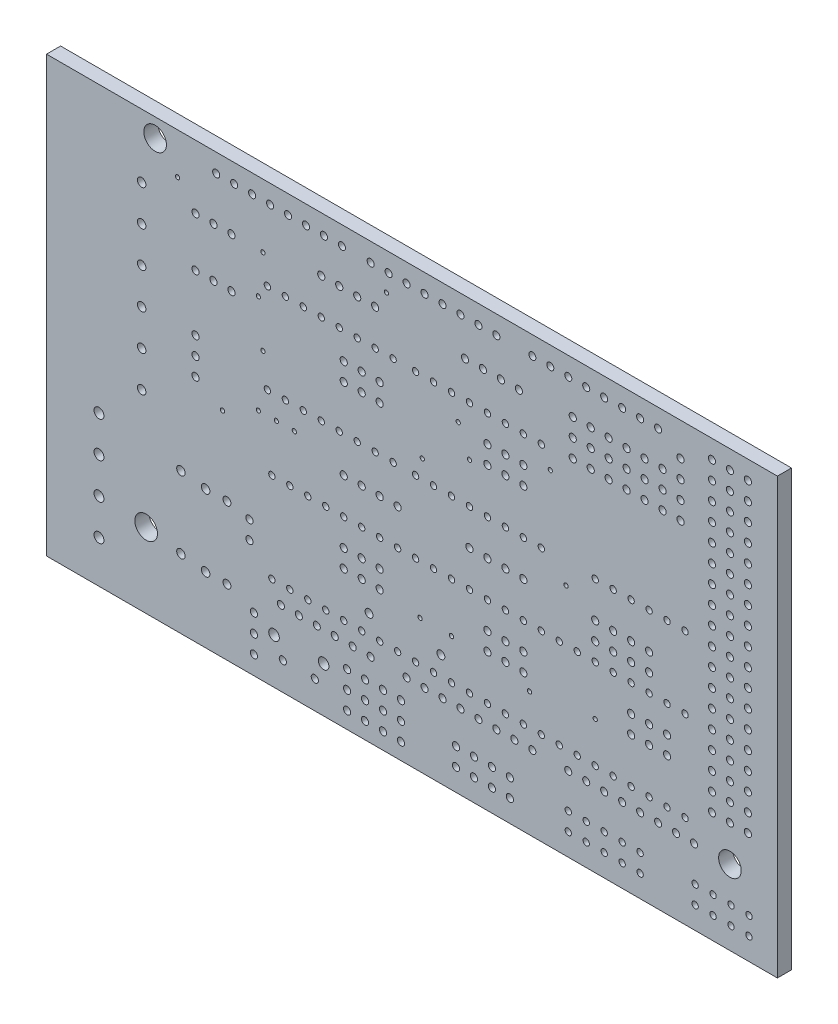
from build123d import *

# Parameters (mm, degrees)
SKETCH1_W           = 131.785247706
SKETCH1_H           = 94.524612159
SKETCH1_R           = 0.510484
SKETCH1_R_2         = 0.5615324
SKETCH1_R_3         = 0.602932652
SKETCH1_R_4         = 0.452212251
SKETCH1_R_5         = 0.7529639
SKETCH1_R_6         = 1.607820406
SKETCH1_R_7         = 0.502443877
SKETCH1_R_8         = 0.7019155
SKETCH1_R_9         = 0.301466326
BOSS_EXTRUDE1_DEPTH = 2
SKETCH4_W           = 136.062514885
SKETCH4_H           = 102.860022968
SKETCH4_W_2         = 103.854835648
SKETCH4_H_2         = 61.764941155
CUT_EXTRUDE1_DEPTH  = 10


with BuildPart() as part:
    # Sketch1 → Boss-Extrude1 (new body)
    with BuildSketch(Plane(origin=(-1.669568433, 0, 0), x_dir=(-1, 0, 0), z_dir=(0, 0, -1))):
        with Locations((-33.736575694, -25.94456792)):
            Rectangle(SKETCH1_W, SKETCH1_H)
        with Locations((-14.63831, -51.3453967)):
            Circle(SKETCH1_R, mode=Mode.SUBTRACT)
        with Locations((-14.000205, -37.600615)):
            Circle(SKETCH1_R, mode=Mode.SUBTRACT)
        with Locations((-14.000205, -40.153035)):
            Circle(SKETCH1_R, mode=Mode.SUBTRACT)
        with Locations((-43.353035, -50.841242702)):
            Circle(SKETCH1_R, mode=Mode.SUBTRACT)
        with Locations((-45.905455, -50.841242702)):
            Circle(SKETCH1_R, mode=Mode.SUBTRACT)
        with Locations((-48.457875, -50.841242702)):
            Circle(SKETCH1_R, mode=Mode.SUBTRACT)
        with Locations((-51.010295, -50.841242702)):
            Circle(SKETCH1_R, mode=Mode.SUBTRACT)
        with Locations((-41.208389619, -40.662217266)):
            Circle(SKETCH1_R_2, mode=Mode.SUBTRACT)
        with Locations((-30.998709619, -40.662217266)):
            Circle(SKETCH1_R_2, mode=Mode.SUBTRACT)
        with Locations((-10.80968, -47.17219)):
            Circle(SKETCH1_R_2, mode=Mode.SUBTRACT)
        with Locations((-10.80968, -36.96251)):
            Circle(SKETCH1_R_2, mode=Mode.SUBTRACT)
        with Locations((-24.209782903, -2.50484)):
            Circle(SKETCH1_R, mode=Mode.SUBTRACT)
        with Locations((-26.762202903, -2.50484)):
            Circle(SKETCH1_R, mode=Mode.SUBTRACT)
        with Locations((-29.314622903, -2.50484)):
            Circle(SKETCH1_R, mode=Mode.SUBTRACT)
        with Locations((-31.867042903, -2.50484)):
            Circle(SKETCH1_R, mode=Mode.SUBTRACT)
        with Locations((-44.629245, -2.50484)):
            Circle(SKETCH1_R, mode=Mode.SUBTRACT)
        with Locations((-47.181665, -2.50484)):
            Circle(SKETCH1_R, mode=Mode.SUBTRACT)
        with Locations((-49.734085, -2.50484)):
            Circle(SKETCH1_R, mode=Mode.SUBTRACT)
        with Locations((-52.286505, -2.50484)):
            Circle(SKETCH1_R, mode=Mode.SUBTRACT)
        with Locations((-7.778732298, -36.96251)):
            Circle(SKETCH1_R_3, mode=Mode.SUBTRACT)
        with Locations((-7.778732298, -47.17219)):
            Circle(SKETCH1_R_3, mode=Mode.SUBTRACT)
        with Locations((-4.269052702, -46.693662298)):
            Circle(SKETCH1_R_3, mode=Mode.SUBTRACT)
        with Locations((-4.269052702, -36.483982298)):
            Circle(SKETCH1_R_3, mode=Mode.SUBTRACT)
        with Locations((-75.258285, -7.131050202)):
            Circle(SKETCH1_R, mode=Mode.SUBTRACT)
        with Locations((-75.258285, -4.578630202)):
            Circle(SKETCH1_R, mode=Mode.SUBTRACT)
        with Locations((-75.258285, -2.026210202)):
            Circle(SKETCH1_R, mode=Mode.SUBTRACT)
        with Locations((-75.258285, 0.526209798)):
            Circle(SKETCH1_R, mode=Mode.SUBTRACT)
        with Locations((-27.40041, -13.99073)):
            Circle(SKETCH1_R, mode=Mode.SUBTRACT)
        with Locations((-27.40041, -11.43831)):
            Circle(SKETCH1_R, mode=Mode.SUBTRACT)
        with Locations((-29.95283, -13.99073)):
            Circle(SKETCH1_R, mode=Mode.SUBTRACT)
        with Locations((-29.95283, -11.43831)):
            Circle(SKETCH1_R, mode=Mode.SUBTRACT)
        with Locations((-32.50525, -13.99073)):
            Circle(SKETCH1_R, mode=Mode.SUBTRACT)
        with Locations((-32.50525, -11.43831)):
            Circle(SKETCH1_R, mode=Mode.SUBTRACT)
        with Locations((-47.81977, -13.99073)):
            Circle(SKETCH1_R, mode=Mode.SUBTRACT)
        with Locations((-47.81977, -11.43831)):
            Circle(SKETCH1_R, mode=Mode.SUBTRACT)
        with Locations((-50.37219, -13.99073)):
            Circle(SKETCH1_R, mode=Mode.SUBTRACT)
        with Locations((-50.37219, -11.43831)):
            Circle(SKETCH1_R, mode=Mode.SUBTRACT)
        with Locations((-52.92461, -13.99073)):
            Circle(SKETCH1_R, mode=Mode.SUBTRACT)
        with Locations((-52.92461, -11.43831)):
            Circle(SKETCH1_R, mode=Mode.SUBTRACT)
        with Locations((-27.40041, -36.96251)):
            Circle(SKETCH1_R, mode=Mode.SUBTRACT)
        with Locations((-27.40041, -34.41009)):
            Circle(SKETCH1_R, mode=Mode.SUBTRACT)
        with Locations((-29.95283, -36.96251)):
            Circle(SKETCH1_R, mode=Mode.SUBTRACT)
        with Locations((-29.95283, -34.41009)):
            Circle(SKETCH1_R, mode=Mode.SUBTRACT)
        with Locations((-32.50525, -36.96251)):
            Circle(SKETCH1_R, mode=Mode.SUBTRACT)
        with Locations((-32.50525, -34.41009)):
            Circle(SKETCH1_R, mode=Mode.SUBTRACT)
        with Locations((-47.81977, -36.96251)):
            Circle(SKETCH1_R, mode=Mode.SUBTRACT)
        with Locations((-47.81977, -34.41009)):
            Circle(SKETCH1_R, mode=Mode.SUBTRACT)
        with Locations((-50.37219, -36.96251)):
            Circle(SKETCH1_R, mode=Mode.SUBTRACT)
        with Locations((-50.37219, -34.41009)):
            Circle(SKETCH1_R, mode=Mode.SUBTRACT)
        with Locations((-52.92461, -36.96251)):
            Circle(SKETCH1_R, mode=Mode.SUBTRACT)
        with Locations((-52.92461, -34.41009)):
            Circle(SKETCH1_R, mode=Mode.SUBTRACT)
        with Locations((-68.23913, -36.96251)):
            Circle(SKETCH1_R, mode=Mode.SUBTRACT)
        with Locations((-68.23913, -34.41009)):
            Circle(SKETCH1_R, mode=Mode.SUBTRACT)
        with Locations((-70.79155, -36.96251)):
            Circle(SKETCH1_R, mode=Mode.SUBTRACT)
        with Locations((-70.79155, -34.41009)):
            Circle(SKETCH1_R, mode=Mode.SUBTRACT)
        with Locations((-73.34397, -36.96251)):
            Circle(SKETCH1_R, mode=Mode.SUBTRACT)
        with Locations((-73.34397, -34.41009)):
            Circle(SKETCH1_R, mode=Mode.SUBTRACT)
        with Locations((-63.13429, -20.37178)):
            Circle(SKETCH1_R_4, mode=Mode.SUBTRACT)
        with Locations((-65.68671, -20.37178)):
            Circle(SKETCH1_R_4, mode=Mode.SUBTRACT)
        with Locations((-68.23913, -20.37178)):
            Circle(SKETCH1_R_4, mode=Mode.SUBTRACT)
        with Locations((-70.79155, -20.37178)):
            Circle(SKETCH1_R_4, mode=Mode.SUBTRACT)
        with Locations((-73.34397, -20.37178)):
            Circle(SKETCH1_R_4, mode=Mode.SUBTRACT)
        with Locations((-75.89639, -20.37178)):
            Circle(SKETCH1_R_4, mode=Mode.SUBTRACT)
        with Locations((-14.63831, -53.8978167)):
            Circle(SKETCH1_R, mode=Mode.SUBTRACT)
        with Locations((-8.895262903, -3.78105)):
            Circle(SKETCH1_R, mode=Mode.SUBTRACT)
        with Locations((-11.447682903, -3.78105)):
            Circle(SKETCH1_R, mode=Mode.SUBTRACT)
        with Locations((-6.342842903, -3.78105)):
            Circle(SKETCH1_R, mode=Mode.SUBTRACT)
        with Locations((-8.895262903, -10.800307097)):
            Circle(SKETCH1_R, mode=Mode.SUBTRACT)
        with Locations((-11.447682903, -10.800307097)):
            Circle(SKETCH1_R, mode=Mode.SUBTRACT)
        with Locations((-6.342842903, -10.800307097)):
            Circle(SKETCH1_R, mode=Mode.SUBTRACT)
        with Locations((-6.343047097, -21.3289375)):
            Circle(SKETCH1_R, mode=Mode.SUBTRACT)
        with Locations((-6.343047097, -23.8813575)):
            Circle(SKETCH1_R, mode=Mode.SUBTRACT)
        with Locations((-6.343047097, -18.7765175)):
            Circle(SKETCH1_R, mode=Mode.SUBTRACT)
        with Locations((-18.7477062, -52.5705583)):
            Circle(SKETCH1_R, mode=Mode.SUBTRACT)
        with Locations((-23.2910138, -52.5705583)):
            Circle(SKETCH1_R, mode=Mode.SUBTRACT)
        with Locations((-17.4970204, -50.0691867)):
            Circle(SKETCH1_R_5, mode=Mode.SUBTRACT)
        with Locations((-24.5416996, -50.0691867)):
            Circle(SKETCH1_R_5, mode=Mode.SUBTRACT)
        with Locations((-27.878937702, -54.191447097)):
            Circle(SKETCH1_R, mode=Mode.SUBTRACT)
        with Locations((-27.878937702, -51.639027097)):
            Circle(SKETCH1_R, mode=Mode.SUBTRACT)
        with Locations((-27.878937702, -49.086607097)):
            Circle(SKETCH1_R, mode=Mode.SUBTRACT)
        with Locations((-30.431459798, -54.191345)):
            Circle(SKETCH1_R, mode=Mode.SUBTRACT)
        with Locations((-30.431459798, -51.638925)):
            Circle(SKETCH1_R, mode=Mode.SUBTRACT)
        with Locations((-30.431459798, -49.086505)):
            Circle(SKETCH1_R, mode=Mode.SUBTRACT)
        with Locations((-32.983777702, -54.191345)):
            Circle(SKETCH1_R, mode=Mode.SUBTRACT)
        with Locations((-32.983777702, -51.638925)):
            Circle(SKETCH1_R, mode=Mode.SUBTRACT)
        with Locations((-32.983777702, -49.086505)):
            Circle(SKETCH1_R, mode=Mode.SUBTRACT)
        with Locations((-35.536299798, -54.191345)):
            Circle(SKETCH1_R, mode=Mode.SUBTRACT)
        with Locations((-35.536299798, -51.638925)):
            Circle(SKETCH1_R, mode=Mode.SUBTRACT)
        with Locations((-35.536299798, -49.086505)):
            Circle(SKETCH1_R, mode=Mode.SUBTRACT)
        with Locations((-43.353035, -53.393764798)):
            Circle(SKETCH1_R, mode=Mode.SUBTRACT)
        with Locations((-45.905455, -53.393764798)):
            Circle(SKETCH1_R, mode=Mode.SUBTRACT)
        with Locations((-48.457875, -53.393764798)):
            Circle(SKETCH1_R, mode=Mode.SUBTRACT)
        with Locations((-51.010295, -53.393764798)):
            Circle(SKETCH1_R, mode=Mode.SUBTRACT)
        with Locations((1.314315, -29.30525)):
            Circle(SKETCH1_R_3, mode=Mode.SUBTRACT)
        with Locations((1.314315, -24.20041)):
            Circle(SKETCH1_R_3, mode=Mode.SUBTRACT)
        with Locations((1.314315, -19.09557)):
            Circle(SKETCH1_R_3, mode=Mode.SUBTRACT)
        with Locations((1.314315, -13.99073)):
            Circle(SKETCH1_R_3, mode=Mode.SUBTRACT)
        with Locations((1.314315, -8.88589)):
            Circle(SKETCH1_R_3, mode=Mode.SUBTRACT)
        with Locations((1.314315, -3.78105)):
            Circle(SKETCH1_R_3, mode=Mode.SUBTRACT)
        with Locations((-84.989335202, -50.841242702)):
            Circle(SKETCH1_R_4, mode=Mode.SUBTRACT)
        with Locations((-84.989335202, -53.393662702)):
            Circle(SKETCH1_R_4, mode=Mode.SUBTRACT)
        with Locations((-82.436915202, -50.841242702)):
            Circle(SKETCH1_R_4, mode=Mode.SUBTRACT)
        with Locations((-82.436915202, -53.393662702)):
            Circle(SKETCH1_R_4, mode=Mode.SUBTRACT)
        with Locations((-79.884495202, -50.841242702)):
            Circle(SKETCH1_R_4, mode=Mode.SUBTRACT)
        with Locations((-79.884495202, -53.393662702)):
            Circle(SKETCH1_R_4, mode=Mode.SUBTRACT)
        with Locations((-77.332075202, -50.841242702)):
            Circle(SKETCH1_R_4, mode=Mode.SUBTRACT)
        with Locations((-77.332075202, -53.393662702)):
            Circle(SKETCH1_R_4, mode=Mode.SUBTRACT)
        with Locations((-26.762305, -7.60968)):
            Circle(SKETCH1_R_4, mode=Mode.SUBTRACT)
        with Locations((-29.314725, -7.60968)):
            Circle(SKETCH1_R_4, mode=Mode.SUBTRACT)
        with Locations((-24.209885, -7.60968)):
            Circle(SKETCH1_R_4, mode=Mode.SUBTRACT)
        with Locations((-21.657465, -7.60968)):
            Circle(SKETCH1_R_4, mode=Mode.SUBTRACT)
        with Locations((-34.419565, -20.37178)):
            Circle(SKETCH1_R_4, mode=Mode.SUBTRACT)
        with Locations((-16.552625, -20.37178)):
            Circle(SKETCH1_R_4, mode=Mode.SUBTRACT)
        with Locations((-34.419565, -7.60968)):
            Circle(SKETCH1_R_4, mode=Mode.SUBTRACT)
        with Locations((-19.105045, -7.60968)):
            Circle(SKETCH1_R_4, mode=Mode.SUBTRACT)
        with Locations((-19.105045, -20.37178)):
            Circle(SKETCH1_R_4, mode=Mode.SUBTRACT)
        with Locations((-21.657465, -20.37178)):
            Circle(SKETCH1_R_4, mode=Mode.SUBTRACT)
        with Locations((-24.209885, -20.37178)):
            Circle(SKETCH1_R_4, mode=Mode.SUBTRACT)
        with Locations((-26.762305, -20.37178)):
            Circle(SKETCH1_R_4, mode=Mode.SUBTRACT)
        with Locations((-29.314725, -20.37178)):
            Circle(SKETCH1_R_4, mode=Mode.SUBTRACT)
        with Locations((-31.867145, -20.37178)):
            Circle(SKETCH1_R_4, mode=Mode.SUBTRACT)
        with Locations((-31.867145, -7.60968)):
            Circle(SKETCH1_R_4, mode=Mode.SUBTRACT)
        with Locations((-16.552625, -7.60968)):
            Circle(SKETCH1_R_4, mode=Mode.SUBTRACT)
        with Locations((-47.81977, -7.60968)):
            Circle(SKETCH1_R_4, mode=Mode.SUBTRACT)
        with Locations((-50.37219, -7.60968)):
            Circle(SKETCH1_R_4, mode=Mode.SUBTRACT)
        with Locations((-45.26735, -7.60968)):
            Circle(SKETCH1_R_4, mode=Mode.SUBTRACT)
        with Locations((-42.71493, -7.60968)):
            Circle(SKETCH1_R_4, mode=Mode.SUBTRACT)
        with Locations((-55.47703, -20.37178)):
            Circle(SKETCH1_R_4, mode=Mode.SUBTRACT)
        with Locations((-37.61009, -20.37178)):
            Circle(SKETCH1_R_4, mode=Mode.SUBTRACT)
        with Locations((-55.47703, -7.60968)):
            Circle(SKETCH1_R_4, mode=Mode.SUBTRACT)
        with Locations((-40.16251, -7.60968)):
            Circle(SKETCH1_R_4, mode=Mode.SUBTRACT)
        with Locations((-40.16251, -20.37178)):
            Circle(SKETCH1_R_4, mode=Mode.SUBTRACT)
        with Locations((-42.71493, -20.37178)):
            Circle(SKETCH1_R_4, mode=Mode.SUBTRACT)
        with Locations((-45.26735, -20.37178)):
            Circle(SKETCH1_R_4, mode=Mode.SUBTRACT)
        with Locations((-47.81977, -20.37178)):
            Circle(SKETCH1_R_4, mode=Mode.SUBTRACT)
        with Locations((-50.37219, -20.37178)):
            Circle(SKETCH1_R_4, mode=Mode.SUBTRACT)
        with Locations((-52.92461, -20.37178)):
            Circle(SKETCH1_R_4, mode=Mode.SUBTRACT)
        with Locations((-52.92461, -7.60968)):
            Circle(SKETCH1_R_4, mode=Mode.SUBTRACT)
        with Locations((-37.61009, -7.60968)):
            Circle(SKETCH1_R_4, mode=Mode.SUBTRACT)
        with Locations((-27.400512097, -30.58146)):
            Circle(SKETCH1_R_4, mode=Mode.SUBTRACT)
        with Locations((-29.952932097, -30.58146)):
            Circle(SKETCH1_R_4, mode=Mode.SUBTRACT)
        with Locations((-24.848092097, -30.58146)):
            Circle(SKETCH1_R_4, mode=Mode.SUBTRACT)
        with Locations((-22.295672097, -30.58146)):
            Circle(SKETCH1_R_4, mode=Mode.SUBTRACT)
        with Locations((-35.057772097, -43.34356)):
            Circle(SKETCH1_R_4, mode=Mode.SUBTRACT)
        with Locations((-17.190832097, -43.34356)):
            Circle(SKETCH1_R_4, mode=Mode.SUBTRACT)
        with Locations((-35.057772097, -30.58146)):
            Circle(SKETCH1_R_4, mode=Mode.SUBTRACT)
        with Locations((-19.743252097, -30.58146)):
            Circle(SKETCH1_R_4, mode=Mode.SUBTRACT)
        with Locations((-19.743252097, -43.34356)):
            Circle(SKETCH1_R_4, mode=Mode.SUBTRACT)
        with Locations((-22.295672097, -43.34356)):
            Circle(SKETCH1_R_4, mode=Mode.SUBTRACT)
        with Locations((-24.848092097, -43.34356)):
            Circle(SKETCH1_R_4, mode=Mode.SUBTRACT)
        with Locations((-27.400512097, -43.34356)):
            Circle(SKETCH1_R_4, mode=Mode.SUBTRACT)
        with Locations((-29.952932097, -43.34356)):
            Circle(SKETCH1_R_4, mode=Mode.SUBTRACT)
        with Locations((-32.505352097, -43.34356)):
            Circle(SKETCH1_R_4, mode=Mode.SUBTRACT)
        with Locations((-32.505352097, -30.58146)):
            Circle(SKETCH1_R_4, mode=Mode.SUBTRACT)
        with Locations((-17.190832097, -30.58146)):
            Circle(SKETCH1_R_4, mode=Mode.SUBTRACT)
        with Locations((-47.81977, -30.58146)):
            Circle(SKETCH1_R_4, mode=Mode.SUBTRACT)
        with Locations((-50.37219, -30.58146)):
            Circle(SKETCH1_R_4, mode=Mode.SUBTRACT)
        with Locations((-45.26735, -30.58146)):
            Circle(SKETCH1_R_4, mode=Mode.SUBTRACT)
        with Locations((-42.71493, -30.58146)):
            Circle(SKETCH1_R_4, mode=Mode.SUBTRACT)
        with Locations((-55.47703, -43.34356)):
            Circle(SKETCH1_R_4, mode=Mode.SUBTRACT)
        with Locations((-37.61009, -43.34356)):
            Circle(SKETCH1_R_4, mode=Mode.SUBTRACT)
        with Locations((-55.47703, -30.58146)):
            Circle(SKETCH1_R_4, mode=Mode.SUBTRACT)
        with Locations((-40.16251, -30.58146)):
            Circle(SKETCH1_R_4, mode=Mode.SUBTRACT)
        with Locations((-40.16251, -43.34356)):
            Circle(SKETCH1_R_4, mode=Mode.SUBTRACT)
        with Locations((-42.71493, -43.34356)):
            Circle(SKETCH1_R_4, mode=Mode.SUBTRACT)
        with Locations((-45.26735, -43.34356)):
            Circle(SKETCH1_R_4, mode=Mode.SUBTRACT)
        with Locations((-47.81977, -43.34356)):
            Circle(SKETCH1_R_4, mode=Mode.SUBTRACT)
        with Locations((-50.37219, -43.34356)):
            Circle(SKETCH1_R_4, mode=Mode.SUBTRACT)
        with Locations((-52.92461, -43.34356)):
            Circle(SKETCH1_R_4, mode=Mode.SUBTRACT)
        with Locations((-52.92461, -30.58146)):
            Circle(SKETCH1_R_4, mode=Mode.SUBTRACT)
        with Locations((-37.61009, -30.58146)):
            Circle(SKETCH1_R_4, mode=Mode.SUBTRACT)
        with Locations((-68.23913, -30.58146)):
            Circle(SKETCH1_R_4, mode=Mode.SUBTRACT)
        with Locations((-70.79155, -30.58146)):
            Circle(SKETCH1_R_4, mode=Mode.SUBTRACT)
        with Locations((-65.68671, -30.58146)):
            Circle(SKETCH1_R_4, mode=Mode.SUBTRACT)
        with Locations((-63.13429, -30.58146)):
            Circle(SKETCH1_R_4, mode=Mode.SUBTRACT)
        with Locations((-75.89639, -43.34356)):
            Circle(SKETCH1_R_4, mode=Mode.SUBTRACT)
        with Locations((-58.02945, -43.34356)):
            Circle(SKETCH1_R_4, mode=Mode.SUBTRACT)
        with Locations((-75.89639, -30.58146)):
            Circle(SKETCH1_R_4, mode=Mode.SUBTRACT)
        with Locations((-60.58187, -30.58146)):
            Circle(SKETCH1_R_4, mode=Mode.SUBTRACT)
        with Locations((-60.58187, -43.34356)):
            Circle(SKETCH1_R_4, mode=Mode.SUBTRACT)
        with Locations((-63.13429, -43.34356)):
            Circle(SKETCH1_R_4, mode=Mode.SUBTRACT)
        with Locations((-65.68671, -43.34356)):
            Circle(SKETCH1_R_4, mode=Mode.SUBTRACT)
        with Locations((-68.23913, -43.34356)):
            Circle(SKETCH1_R_4, mode=Mode.SUBTRACT)
        with Locations((-70.79155, -43.34356)):
            Circle(SKETCH1_R_4, mode=Mode.SUBTRACT)
        with Locations((-73.34397, -43.34356)):
            Circle(SKETCH1_R_4, mode=Mode.SUBTRACT)
        with Locations((-73.34397, -30.58146)):
            Circle(SKETCH1_R_4, mode=Mode.SUBTRACT)
        with Locations((-58.02945, -30.58146)):
            Circle(SKETCH1_R_4, mode=Mode.SUBTRACT)
        with Locations((-84.82986, -40.79114)):
            Circle(SKETCH1_R, mode=Mode.SUBTRACT)
        with Locations((-84.82986, -38.23872)):
            Circle(SKETCH1_R, mode=Mode.SUBTRACT)
        with Locations((-84.82986, -35.6863)):
            Circle(SKETCH1_R, mode=Mode.SUBTRACT)
        with Locations((-84.82986, -33.13388)):
            Circle(SKETCH1_R, mode=Mode.SUBTRACT)
        with Locations((-84.82986, -30.58146)):
            Circle(SKETCH1_R, mode=Mode.SUBTRACT)
        with Locations((-84.82986, -28.02904)):
            Circle(SKETCH1_R, mode=Mode.SUBTRACT)
        with Locations((-84.82986, -25.47662)):
            Circle(SKETCH1_R, mode=Mode.SUBTRACT)
        with Locations((-84.82986, -22.9242)):
            Circle(SKETCH1_R, mode=Mode.SUBTRACT)
        with Locations((-84.82986, -20.37178)):
            Circle(SKETCH1_R, mode=Mode.SUBTRACT)
        with Locations((-84.82986, -17.81936)):
            Circle(SKETCH1_R, mode=Mode.SUBTRACT)
        with Locations((-84.82986, -15.26694)):
            Circle(SKETCH1_R, mode=Mode.SUBTRACT)
        with Locations((-84.82986, -12.71452)):
            Circle(SKETCH1_R, mode=Mode.SUBTRACT)
        with Locations((-84.82986, -10.1621)):
            Circle(SKETCH1_R, mode=Mode.SUBTRACT)
        with Locations((-84.82986, -7.60968)):
            Circle(SKETCH1_R, mode=Mode.SUBTRACT)
        with Locations((-84.82986, -5.05726)):
            Circle(SKETCH1_R, mode=Mode.SUBTRACT)
        with Locations((-84.82986, -2.50484)):
            Circle(SKETCH1_R, mode=Mode.SUBTRACT)
        with Locations((-84.82986, 0.04758)):
            Circle(SKETCH1_R, mode=Mode.SUBTRACT)
        with Locations((-84.82986, 2.6)):
            Circle(SKETCH1_R, mode=Mode.SUBTRACT)
        with Locations((-59.30566, -53.393662702)):
            Circle(SKETCH1_R_4, mode=Mode.SUBTRACT)
        with Locations((-59.30566, -50.841242702)):
            Circle(SKETCH1_R_4, mode=Mode.SUBTRACT)
        with Locations((-61.85808, -53.393662702)):
            Circle(SKETCH1_R_4, mode=Mode.SUBTRACT)
        with Locations((-61.85808, -50.841242702)):
            Circle(SKETCH1_R_4, mode=Mode.SUBTRACT)
        with Locations((-64.4105, -53.393662702)):
            Circle(SKETCH1_R_4, mode=Mode.SUBTRACT)
        with Locations((-64.4105, -50.841242702)):
            Circle(SKETCH1_R_4, mode=Mode.SUBTRACT)
        with Locations((-66.96292, -53.393662702)):
            Circle(SKETCH1_R_4, mode=Mode.SUBTRACT)
        with Locations((-66.96292, -50.841242702)):
            Circle(SKETCH1_R_4, mode=Mode.SUBTRACT)
        with Locations((-69.51534, -53.393662702)):
            Circle(SKETCH1_R_4, mode=Mode.SUBTRACT)
        with Locations((-69.51534, -50.841242702)):
            Circle(SKETCH1_R_4, mode=Mode.SUBTRACT)
        with Locations((-82.27744, -45.89598)):
            Circle(SKETCH1_R_6, mode=Mode.SUBTRACT)
        with Locations((0.67621, -45.89598)):
            Circle(SKETCH1_R_6, mode=Mode.SUBTRACT)
        with Locations((-0.6, 2.6)):
            Circle(SKETCH1_R_6, mode=Mode.SUBTRACT)
        with Locations((-21.01936, -45.89598)):
            Circle(SKETCH1_R_7, mode=Mode.SUBTRACT)
        with Locations((-23.57178, -45.89598)):
            Circle(SKETCH1_R_7, mode=Mode.SUBTRACT)
        with Locations((-79.72502, 2.6)):
            Circle(SKETCH1_R_7, mode=Mode.SUBTRACT)
        with Locations((-82.27744, 2.6)):
            Circle(SKETCH1_R_7, mode=Mode.SUBTRACT)
        with Locations((-36.33388, -45.89598)):
            Circle(SKETCH1_R_7, mode=Mode.SUBTRACT)
        with Locations((-38.8863, -45.89598)):
            Circle(SKETCH1_R_7, mode=Mode.SUBTRACT)
        with Locations((-41.43872, -45.89598)):
            Circle(SKETCH1_R_7, mode=Mode.SUBTRACT)
        with Locations((-43.99114, -45.89598)):
            Circle(SKETCH1_R_7, mode=Mode.SUBTRACT)
        with Locations((-46.54356, -45.89598)):
            Circle(SKETCH1_R_7, mode=Mode.SUBTRACT)
        with Locations((-49.09598, -45.89598)):
            Circle(SKETCH1_R_7, mode=Mode.SUBTRACT)
        with Locations((-51.6484, -45.89598)):
            Circle(SKETCH1_R_7, mode=Mode.SUBTRACT)
        with Locations((-54.20082, -45.89598)):
            Circle(SKETCH1_R_7, mode=Mode.SUBTRACT)
        with Locations((-59.30566, -45.89598)):
            Circle(SKETCH1_R_7, mode=Mode.SUBTRACT)
        with Locations((-61.85808, -45.89598)):
            Circle(SKETCH1_R_7, mode=Mode.SUBTRACT)
        with Locations((-64.4105, -45.89598)):
            Circle(SKETCH1_R_7, mode=Mode.SUBTRACT)
        with Locations((-66.96292, -45.89598)):
            Circle(SKETCH1_R_7, mode=Mode.SUBTRACT)
        with Locations((-69.51534, -45.89598)):
            Circle(SKETCH1_R_7, mode=Mode.SUBTRACT)
        with Locations((-72.06776, -45.89598)):
            Circle(SKETCH1_R_7, mode=Mode.SUBTRACT)
        with Locations((-74.62018, -45.89598)):
            Circle(SKETCH1_R_7, mode=Mode.SUBTRACT)
        with Locations((-77.1726, -45.89598)):
            Circle(SKETCH1_R_7, mode=Mode.SUBTRACT)
        with Locations((-9.278228, 2.6)):
            Circle(SKETCH1_R_7, mode=Mode.SUBTRACT)
        with Locations((-43.99114, 2.6)):
            Circle(SKETCH1_R_7, mode=Mode.SUBTRACT)
        with Locations((-41.43872, 2.6)):
            Circle(SKETCH1_R_7, mode=Mode.SUBTRACT)
        with Locations((-38.8863, 2.6)):
            Circle(SKETCH1_R_7, mode=Mode.SUBTRACT)
        with Locations((-36.33388, 2.6)):
            Circle(SKETCH1_R_7, mode=Mode.SUBTRACT)
        with Locations((-33.78146, 2.6)):
            Circle(SKETCH1_R_7, mode=Mode.SUBTRACT)
        with Locations((-31.22904, 2.6)):
            Circle(SKETCH1_R_7, mode=Mode.SUBTRACT)
        with Locations((-27.145168, 2.6)):
            Circle(SKETCH1_R_7, mode=Mode.SUBTRACT)
        with Locations((-24.592748, 2.6)):
            Circle(SKETCH1_R_7, mode=Mode.SUBTRACT)
        with Locations((-22.040328, 2.6)):
            Circle(SKETCH1_R_7, mode=Mode.SUBTRACT)
        with Locations((-19.487908, 2.6)):
            Circle(SKETCH1_R_7, mode=Mode.SUBTRACT)
        with Locations((-16.935488, 2.6)):
            Circle(SKETCH1_R_7, mode=Mode.SUBTRACT)
        with Locations((-14.383068, 2.6)):
            Circle(SKETCH1_R_7, mode=Mode.SUBTRACT)
        with Locations((-54.20082, 2.6)):
            Circle(SKETCH1_R_7, mode=Mode.SUBTRACT)
        with Locations((-56.75324, 2.6)):
            Circle(SKETCH1_R_7, mode=Mode.SUBTRACT)
        with Locations((-59.30566, 2.6)):
            Circle(SKETCH1_R_7, mode=Mode.SUBTRACT)
        with Locations((-61.85808, 2.6)):
            Circle(SKETCH1_R_7, mode=Mode.SUBTRACT)
        with Locations((-64.4105, 2.6)):
            Circle(SKETCH1_R_7, mode=Mode.SUBTRACT)
        with Locations((-66.96292, 2.6)):
            Circle(SKETCH1_R_7, mode=Mode.SUBTRACT)
        with Locations((-69.51534, 2.6)):
            Circle(SKETCH1_R_7, mode=Mode.SUBTRACT)
        with Locations((-72.06776, 2.6)):
            Circle(SKETCH1_R_7, mode=Mode.SUBTRACT)
        with Locations((-79.72502, 0.04758)):
            Circle(SKETCH1_R_7, mode=Mode.SUBTRACT)
        with Locations((-82.27744, 0.04758)):
            Circle(SKETCH1_R_7, mode=Mode.SUBTRACT)
        with Locations((-79.72502, -2.50484)):
            Circle(SKETCH1_R_7, mode=Mode.SUBTRACT)
        with Locations((-82.27744, -2.50484)):
            Circle(SKETCH1_R_7, mode=Mode.SUBTRACT)
        with Locations((-79.72502, -5.05726)):
            Circle(SKETCH1_R_7, mode=Mode.SUBTRACT)
        with Locations((-82.27744, -5.05726)):
            Circle(SKETCH1_R_7, mode=Mode.SUBTRACT)
        with Locations((-79.72502, -7.60968)):
            Circle(SKETCH1_R_7, mode=Mode.SUBTRACT)
        with Locations((-82.27744, -7.60968)):
            Circle(SKETCH1_R_7, mode=Mode.SUBTRACT)
        with Locations((-79.72502, -10.1621)):
            Circle(SKETCH1_R_7, mode=Mode.SUBTRACT)
        with Locations((-82.27744, -10.1621)):
            Circle(SKETCH1_R_7, mode=Mode.SUBTRACT)
        with Locations((-79.72502, -12.71452)):
            Circle(SKETCH1_R_7, mode=Mode.SUBTRACT)
        with Locations((-82.27744, -12.71452)):
            Circle(SKETCH1_R_7, mode=Mode.SUBTRACT)
        with Locations((-79.72502, -15.26694)):
            Circle(SKETCH1_R_7, mode=Mode.SUBTRACT)
        with Locations((-82.27744, -15.26694)):
            Circle(SKETCH1_R_7, mode=Mode.SUBTRACT)
        with Locations((-79.72502, -17.81936)):
            Circle(SKETCH1_R_7, mode=Mode.SUBTRACT)
        with Locations((-82.27744, -17.81936)):
            Circle(SKETCH1_R_7, mode=Mode.SUBTRACT)
        with Locations((-79.72502, -20.37178)):
            Circle(SKETCH1_R_7, mode=Mode.SUBTRACT)
        with Locations((-82.27744, -20.37178)):
            Circle(SKETCH1_R_7, mode=Mode.SUBTRACT)
        with Locations((-79.72502, -22.9242)):
            Circle(SKETCH1_R_7, mode=Mode.SUBTRACT)
        with Locations((-82.27744, -22.9242)):
            Circle(SKETCH1_R_7, mode=Mode.SUBTRACT)
        with Locations((-79.72502, -25.47662)):
            Circle(SKETCH1_R_7, mode=Mode.SUBTRACT)
        with Locations((-82.27744, -25.47662)):
            Circle(SKETCH1_R_7, mode=Mode.SUBTRACT)
        with Locations((-79.72502, -28.02904)):
            Circle(SKETCH1_R_7, mode=Mode.SUBTRACT)
        with Locations((-82.27744, -28.02904)):
            Circle(SKETCH1_R_7, mode=Mode.SUBTRACT)
        with Locations((-79.72502, -30.58146)):
            Circle(SKETCH1_R_7, mode=Mode.SUBTRACT)
        with Locations((-82.27744, -30.58146)):
            Circle(SKETCH1_R_7, mode=Mode.SUBTRACT)
        with Locations((-79.72502, -33.13388)):
            Circle(SKETCH1_R_7, mode=Mode.SUBTRACT)
        with Locations((-82.27744, -33.13388)):
            Circle(SKETCH1_R_7, mode=Mode.SUBTRACT)
        with Locations((-79.72502, -35.6863)):
            Circle(SKETCH1_R_7, mode=Mode.SUBTRACT)
        with Locations((-82.27744, -35.6863)):
            Circle(SKETCH1_R_7, mode=Mode.SUBTRACT)
        with Locations((-79.72502, -38.23872)):
            Circle(SKETCH1_R_7, mode=Mode.SUBTRACT)
        with Locations((-82.27744, -38.23872)):
            Circle(SKETCH1_R_7, mode=Mode.SUBTRACT)
        with Locations((-26.1242, -45.89598)):
            Circle(SKETCH1_R_7, mode=Mode.SUBTRACT)
        with Locations((-28.67662, -45.89598)):
            Circle(SKETCH1_R_7, mode=Mode.SUBTRACT)
        with Locations((-11.830648, 2.6)):
            Circle(SKETCH1_R_7, mode=Mode.SUBTRACT)
        with Locations((-79.72502, -40.79114)):
            Circle(SKETCH1_R_7, mode=Mode.SUBTRACT)
        with Locations((-82.27744, -40.79114)):
            Circle(SKETCH1_R_7, mode=Mode.SUBTRACT)
        with Locations((-18.46694, -45.89598)):
            Circle(SKETCH1_R_7, mode=Mode.SUBTRACT)
        with Locations((-49.09598, 2.6)):
            Circle(SKETCH1_R_7, mode=Mode.SUBTRACT)
        with Locations((-46.54356, 2.6)):
            Circle(SKETCH1_R_7, mode=Mode.SUBTRACT)
        with Locations((-31.22904, -45.89598)):
            Circle(SKETCH1_R_7, mode=Mode.SUBTRACT)
        with Locations((-14.63831, -48.7674525)):
            Circle(SKETCH1_R, mode=Mode.SUBTRACT)
        with Locations((-62.496185, -2.026312298)):
            Circle(SKETCH1_R, mode=Mode.SUBTRACT)
        with Locations((-62.496185, -4.578732298)):
            Circle(SKETCH1_R, mode=Mode.SUBTRACT)
        with Locations((-62.496185, -7.131152298)):
            Circle(SKETCH1_R, mode=Mode.SUBTRACT)
        with Locations((-59.943765, -2.026312298)):
            Circle(SKETCH1_R, mode=Mode.SUBTRACT)
        with Locations((-59.943765, -4.578732298)):
            Circle(SKETCH1_R, mode=Mode.SUBTRACT)
        with Locations((-59.943765, -7.131152298)):
            Circle(SKETCH1_R, mode=Mode.SUBTRACT)
        with Locations((-27.40041, -25.476824194)):
            Circle(SKETCH1_R, mode=Mode.SUBTRACT)
        with Locations((-29.95283, -25.476824194)):
            Circle(SKETCH1_R, mode=Mode.SUBTRACT)
        with Locations((-32.50525, -25.476824194)):
            Circle(SKETCH1_R, mode=Mode.SUBTRACT)
        with Locations((-35.05767, -25.476824194)):
            Circle(SKETCH1_R, mode=Mode.SUBTRACT)
        with Locations((7.3763125, -35.207670202)):
            Circle(SKETCH1_R_8, mode=Mode.SUBTRACT)
        with Locations((7.3763125, -40.312510202)):
            Circle(SKETCH1_R_8, mode=Mode.SUBTRACT)
        with Locations((7.3763125, -45.417350202)):
            Circle(SKETCH1_R_8, mode=Mode.SUBTRACT)
        with Locations((7.3763125, -50.522190202)):
            Circle(SKETCH1_R_8, mode=Mode.SUBTRACT)
        with Locations((-67.601025, -2.026312298)):
            Circle(SKETCH1_R, mode=Mode.SUBTRACT)
        with Locations((-67.601025, -4.578732298)):
            Circle(SKETCH1_R, mode=Mode.SUBTRACT)
        with Locations((-67.601025, -7.131152298)):
            Circle(SKETCH1_R, mode=Mode.SUBTRACT)
        with Locations((-65.048605, -2.026312298)):
            Circle(SKETCH1_R, mode=Mode.SUBTRACT)
        with Locations((-65.048605, -4.578732298)):
            Circle(SKETCH1_R, mode=Mode.SUBTRACT)
        with Locations((-65.048605, -7.131152298)):
            Circle(SKETCH1_R, mode=Mode.SUBTRACT)
        with Locations((-45.26735, -25.476722097)):
            Circle(SKETCH1_R, mode=Mode.SUBTRACT)
        with Locations((-47.81977, -25.476722097)):
            Circle(SKETCH1_R, mode=Mode.SUBTRACT)
        with Locations((-50.37219, -25.476722097)):
            Circle(SKETCH1_R, mode=Mode.SUBTRACT)
        with Locations((-52.92461, -25.476722097)):
            Circle(SKETCH1_R, mode=Mode.SUBTRACT)
        with Locations((-72.705865, -2.026312298)):
            Circle(SKETCH1_R, mode=Mode.SUBTRACT)
        with Locations((-72.705865, -4.578732298)):
            Circle(SKETCH1_R, mode=Mode.SUBTRACT)
        with Locations((-72.705865, -7.131152298)):
            Circle(SKETCH1_R, mode=Mode.SUBTRACT)
        with Locations((-70.153445, -2.026312298)):
            Circle(SKETCH1_R, mode=Mode.SUBTRACT)
        with Locations((-70.153445, -4.578732298)):
            Circle(SKETCH1_R, mode=Mode.SUBTRACT)
        with Locations((-70.153445, -7.131152298)):
            Circle(SKETCH1_R, mode=Mode.SUBTRACT)
        with Locations((-63.13429, -25.47662)):
            Circle(SKETCH1_R, mode=Mode.SUBTRACT)
        with Locations((-65.68671, -25.47662)):
            Circle(SKETCH1_R, mode=Mode.SUBTRACT)
        with Locations((-68.23913, -25.47662)):
            Circle(SKETCH1_R, mode=Mode.SUBTRACT)
        with Locations((-70.79155, -25.47662)):
            Circle(SKETCH1_R, mode=Mode.SUBTRACT)
        with Locations((-63.13429, -28.02904)):
            Circle(SKETCH1_R, mode=Mode.SUBTRACT)
        with Locations((-65.68671, -28.02904)):
            Circle(SKETCH1_R, mode=Mode.SUBTRACT)
        with Locations((-68.23913, -28.02904)):
            Circle(SKETCH1_R, mode=Mode.SUBTRACT)
        with Locations((-70.79155, -28.02904)):
            Circle(SKETCH1_R, mode=Mode.SUBTRACT)
        with Locations((-38.248195, -37.600615)):
            Circle(SKETCH1_R_9, mode=Mode.SUBTRACT)
        with Locations((-15.276415, -23.562305)):
            Circle(SKETCH1_R_9, mode=Mode.SUBTRACT)
        with Locations((-20.381255, -23.562305)):
            Circle(SKETCH1_R_9, mode=Mode.SUBTRACT)
        with Locations((-17.828835, -23.562305)):
            Circle(SKETCH1_R_9, mode=Mode.SUBTRACT)
        with Locations((-15.276415, -9.523995)):
            Circle(SKETCH1_R_9, mode=Mode.SUBTRACT)
        with Locations((-10.171575, -26.114725)):
            Circle(SKETCH1_R_9, mode=Mode.SUBTRACT)
        with Locations((-38.5672475, -17.81936)):
            Circle(SKETCH1_R_9, mode=Mode.SUBTRACT)
        with Locations((-15.91452, -3.78105)):
            Circle(SKETCH1_R_9, mode=Mode.SUBTRACT)
        with Locations((-3.790525, -0.590525)):
            Circle(SKETCH1_R_9, mode=Mode.SUBTRACT)
        with Locations((-53.7924328, -38.876825)):
            Circle(SKETCH1_R_9, mode=Mode.SUBTRACT)
        with Locations((-63.13429, -37.600615)):
            Circle(SKETCH1_R_9, mode=Mode.SUBTRACT)
        with Locations((-42.71493, -37.600615)):
            Circle(SKETCH1_R_9, mode=Mode.SUBTRACT)
        with Locations((-43.6720875, -10.800205)):
            Circle(SKETCH1_R_9, mode=Mode.SUBTRACT)
        with Locations((-33.4624075, 0.04758)):
            Circle(SKETCH1_R_9, mode=Mode.SUBTRACT)
        with Locations((-15.91452, -15.905045)):
            Circle(SKETCH1_R_9, mode=Mode.SUBTRACT)
        with Locations((-45.26735, -14.628835)):
            Circle(SKETCH1_R_9, mode=Mode.SUBTRACT)
        with Locations((-58.9866075, -23.2432525)):
            Circle(SKETCH1_R_9, mode=Mode.SUBTRACT)
        with Locations((-56.75324, -10.1621)):
            Circle(SKETCH1_R_9, mode=Mode.SUBTRACT)
    extrude(amount=-BOSS_EXTRUDE1_DEPTH)

    # Sketch4 → Cut-Extrude1 (cut)
    with BuildSketch(Plane(origin=(-1.669568433, 0, 2), x_dir=(1, 0, 0), z_dir=(0, 0, 1))):
        with Locations((34.393787782, -25.325851879)):
            Rectangle(SKETCH4_W, SKETCH4_H)
        with Locations((37.096518848, -25.646194887)):
            Rectangle(SKETCH4_W_2, SKETCH4_H_2, mode=Mode.SUBTRACT)
    extrude(amount=-CUT_EXTRUDE1_DEPTH, mode=Mode.SUBTRACT)


solid = part.part
